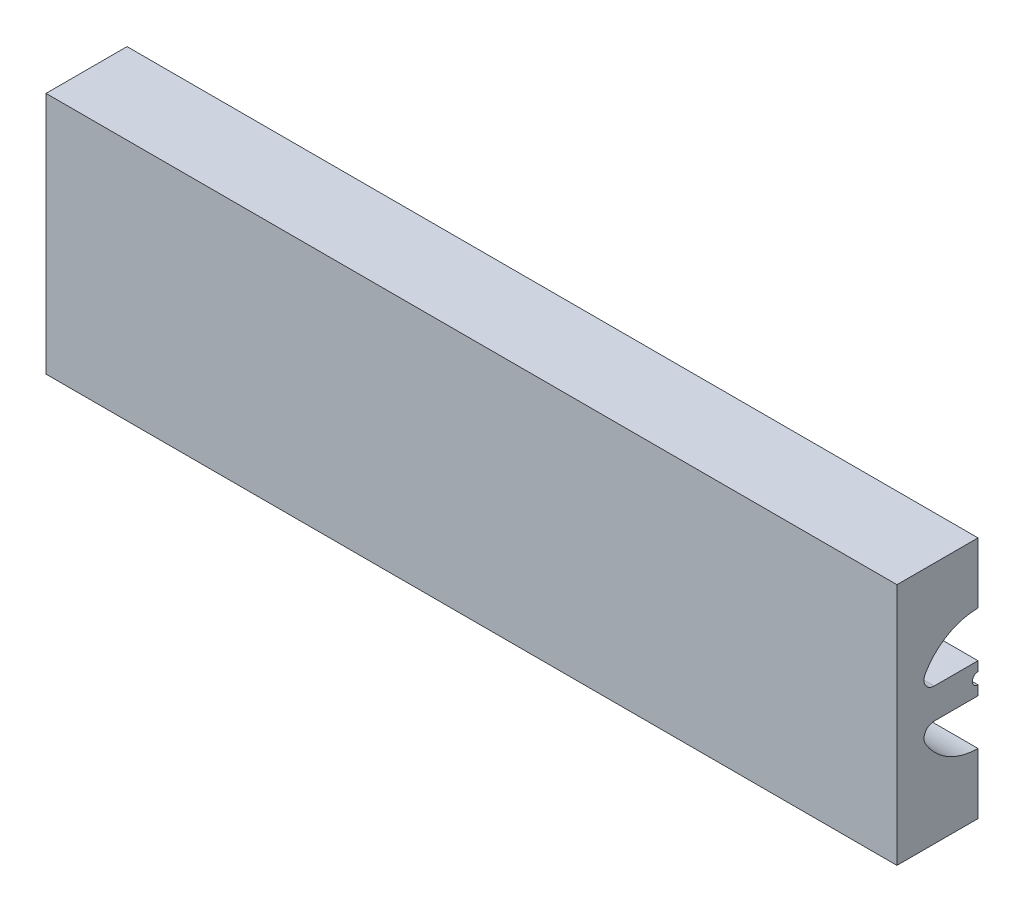
from build123d import *

# Parameters (mm, degrees)
SKETCH2_W                    = 1066.8
SKETCH2_H                    = 304.8
BOSS_EXTRUDE1_DEPTH          = 50.8
CUT_EXTRUDE1_DEPTH           = 1107.294920223
CUT_EXTRUDE1_DEPTH_BACK      = 1107.294920223
SKETCH4_R                    = 7.14375
CUT_EXTRUDE3_DEPTH           = 1037.520325732
FILLET4_R                    = 6.35
REGISTRATION_HOLE_SKETCH_R   = 12.7
BASE_REGISTRATION_HOLE_DEPTH = 50.8
LPATTERN3_COUNT              = 4
LPATTERN3_PITCH              = 304.8
LPATTERN3_COUNT_DIR2         = 2
LPATTERN3_PITCH_DIR2         = 228.6
SKETCH7_R                    = 76.2
CUT_EXTRUDE4_DEPTH           = 12.7
FILLET5_R                    = 12.7


# Read off the part's stored shape, not the designer's step: Indent1
with BuildPart() as part:
    # Sketch2 → Boss-Extrude1 (new, symmetric)
    with BuildSketch(Plane.XY):
        with Locations((1206.465176028, 136.123084384)):
            Rectangle(SKETCH2_W, SKETCH2_H)
    extrude(amount=BOSS_EXTRUDE1_DEPTH, both=True)

    # Indent1 outline → Indent1 (revolve, cut)
    with BuildSketch(Plane(origin=(0, 136.123084384, -50.8), x_dir=(0, 1, 0), z_dir=(0, 0, -1))):
        with BuildLine():
            Line((76.2, 1667.322776028), (0, 1667.322776028))
            Line((0, 1667.322776028), (0, 745.607576028))
            Line((0, 745.607576028), (23.064945381, 745.607576028))
            add(Edge.make_bspline(
                [(23.064945381, 745.607576028), (23.566825523, 748.91437787), (25.363204219, 760.90488429), (28.330664868, 781.598898763), (31.871058885, 807.703400336), (35.241099853, 833.832092117), (38.460845457, 859.980959498), (42.572514827, 894.869141414), (47.400937928, 938.517112788), (52.760650205, 990.942462001), (57.722301111, 1043.408031291), (62.308317352, 1095.908289185), (67.933123727, 1165.949858053), (72.828043506, 1236.047318759), (76.911244662, 1306.192759412), (79.080505646, 1350.052513699), (80.485669281, 1383.896744518), (81.068244998, 1400.195093482), (81.313954963, 1407.717593946)],
                knots=[0.116308657, 0.116308657, 0.116308657, 0.116308657, 0.125901739, 0.151082086, 0.176262434, 0.201442782, 0.22662313, 0.251803477, 0.302164173, 0.352524868, 0.402885564, 0.453246259, 0.503606955, 0.604328346, 0.654689041, 0.705049737, 0.730230084, 0.75181382, 0.75181382, 0.75181382, 0.75181382], degree=3))
            ThreePointArc((81.313954963, 1407.717593946), (80.564993874, 1410.923022844), (78.31179575, 1413.322776028))
            ThreePointArc((78.31179575, 1413.322776028), (76.063072477, 1415.714189378), (75.309046779, 1418.909038266))
            add(Edge.make_bspline(
                [(75.309046779, 1418.909038266), (75.323959024, 1419.411481069), (75.408519742, 1422.276130669), (75.558482998, 1427.503133809), (75.676289458, 1432.228116929), (75.735192688, 1434.590608489), (75.838475179, 1438.733064052), (76.045040161, 1447.017975177), (76.2, 1459.45016933), (76.2, 1467.737655163), (76.2, 1471.88139808), (76.2, 1476.663773407), (76.2, 1486.228524062), (76.2, 1500.575650045), (76.2, 1510.1404007), (76.2, 1514.922776028), (76.2, 1565.722776028), (76.2, 1616.522776028), (76.2, 1667.322776028)],
                knots=[0.761574077, 0.761574077, 0.761574077, 0.761574077, 0.763021384, 0.769825774, 0.776630163, 0.776630163, 0.776630163, 0.788561161, 0.800492159, 0.812423157, 0.812423157, 0.812423157, 0.826192956, 0.839962756, 0.853732555, 0.853732555, 0.853732555, 1, 1, 1, 1], degree=3))
        make_face()
    revolve(axis=Axis((0, 136.123084384, -50.8), (1, 0, 0)), mode=Mode.SUBTRACT)

    # Sketch4 → Cut-Extrude1 (cut, two sides: drawn at the far end of the back side and taken through both)
    with BuildSketch(Plane.ZY.offset(-1739.865176028).offset(-CUT_EXTRUDE1_DEPTH_BACK)):
        with Locations((-50.8, 136.123084384)):
            Circle(SKETCH4_R)
    extrude(amount=CUT_EXTRUDE1_DEPTH + CUT_EXTRUDE1_DEPTH_BACK, mode=Mode.SUBTRACT)

    # Sketch6 → Cut-Extrude3 (cut, through all)
    with BuildSketch(Plane.ZY.offset(-1667.322776028)):
        with BuildLine():
            Line((22.980332745, 117.073084384), (-50.8, 117.073084384))
            Line((-50.8, 117.073084384), (-50.8, 59.923084384))
            ThreePointArc((-50.8, 59.923084384), (-4.1372204, 75.881694958), (22.980332745, 117.073084384))
        make_face()
        with BuildLine():
            Line((-50.8, 155.173084384), (22.980332745, 155.173084384))
            ThreePointArc((22.980332745, 155.173084384), (-4.1372204, 196.364473811), (-50.8, 212.323084384))
            Line((-50.8, 212.323084384), (-50.8, 199.623084384))
            Line((-50.8, 199.623084384), (-50.8, 155.173084384))
        make_face()
    extrude(amount=-CUT_EXTRUDE3_DEPTH, mode=Mode.SUBTRACT)

    # Fillet4
    fillet4_edges = [part.edges().sort_by_distance(p)[0] for p in [
        (745.607576028, 136.123084384, -27.735054619),
    ]]
    fillet(fillet4_edges, radius=FILLET4_R)

    # Registration Hole Sketch → Base-Registration-Hole (cut)
    with BuildSketch(Plane(origin=(0, 0, -50.8), x_dir=(-1, 0, 0), z_dir=(0, 0, -1))):
        with Locations((-745.607576028, 21.823084384)):
            Circle(REGISTRATION_HOLE_SKETCH_R)
    base_registration_hole = extrude(amount=-BASE_REGISTRATION_HOLE_DEPTH, mode=Mode.SUBTRACT)

    # LPattern3: Base-Registration-Hole 4 × 2
    with Locations(*[(i * LPATTERN3_PITCH, j * LPATTERN3_PITCH_DIR2, 0) for i in range(LPATTERN3_COUNT) for j in range(LPATTERN3_COUNT_DIR2) if (i, j) != (0, 0)]):
        add(base_registration_hole, mode=Mode.SUBTRACT)

    # Sketch7 → Cut-Extrude4 (cut)
    with BuildSketch(Plane.ZY.offset(-1667.322776028)):
        with Locations((-50.8, 136.123084384)):
            Circle(SKETCH7_R)
    extrude(amount=-CUT_EXTRUDE4_DEPTH, mode=Mode.SUBTRACT)

    # Fillet5
    # the kernel refuses this fillet: 12.7 mm, written as the material it adds along each edge
    with BuildSketch(Plane(origin=(1680.022776028, 136.123084384, -50.8), x_dir=(0, -0.6204773534699832, 0.7842243644716003), z_dir=(0, -0.7842243644716003, -0.6204773534699832))) as fillet5_piece_1_section:
        with BuildLine():
            CenterArc((76.2 - FILLET5_R, FILLET5_R), FILLET5_R, 270, 90)
            Line((76.2 - FILLET5_R, 0), (76.2, 0))
            Line((76.2, 0), (76.2, FILLET5_R))
        make_face()
    fillet5_piece_1 = revolve(axis=Axis((1680.022776028, 136.123084384, -50.8), (-1, 0, 0)), revolution_arc=38.351001738, mode=Mode.PRIVATE)
    fillet5_piece_1 = split(fillet5_piece_1, bisect_by=Plane(origin=(1677.149054572, 117.073084384, 21.679553224), z_dir=(0, 1, 0)), keep=Keep.TOP, mode=Mode.PRIVATE)
    add(fillet5_piece_1)
    with BuildSketch(Plane(origin=(1680.022776028, 117.073084384, 22.980332745), x_dir=(0, -0.9256147934109615, -0.37846697903355186), z_dir=(1, 0, 0))) as fillet5_piece_2:
        with BuildLine():
            CenterArc((18.865839358, 12.583660567), FILLET5_R, 157.761243907, 120)
            Line((7.110531482, 17.390191201), (0, 0))
            ThreePointArc((0, 0), (10.290457832, -0.698036598), (20.580915663, 0))
        make_face()
    extrude(amount=59.8424)
    with BuildSketch(Plane(origin=(1680.022776028, 155.173084384, 22.980332745), x_dir=(0, 0, -1), z_dir=(1, 0, 0))) as fillet5_piece_3:
        with BuildLine():
            CenterArc((18.787719605, 12.7), FILLET5_R, 150, 120)
            ThreePointArc((7.789196977, 19.05), (3.248485487, 9.789183802), (0, 0))
            Line((0, 0), (18.787719605, 0))
        make_face()
    extrude(amount=59.8424)
    with BuildSketch(Plane(origin=(1680.022776028, 136.123084384, -50.8), x_dir=(0, 0, 1), z_dir=(0, -1, 0))) as fillet5_piece_4_section:
        with BuildLine():
            CenterArc((76.2 - FILLET5_R, FILLET5_R), FILLET5_R, 270, 90)
            Line((76.2, FILLET5_R), (76.2, 0))
            Line((76.2, 0), (76.2 - FILLET5_R, 0))
        make_face()
    fillet5_piece_4 = revolve(axis=Axis((1680.022776028, 136.123084384, -50.8), (-1, 0, 0)), revolution_arc=38.351001738, mode=Mode.PRIVATE)
    fillet5_piece_4 = split(fillet5_piece_4, bisect_by=Plane(origin=(1677.14905497, 155.173084384, 21.679553319), z_dir=(0, -1, 0)), keep=Keep.TOP, mode=Mode.PRIVATE)
    add(fillet5_piece_4)
    with BuildSketch(Plane(origin=(1628.570486869, 117.073084384, 22.980332745), x_dir=(0, -0.9256147934109611, -0.378466979033553), z_dir=(1, 0, 0))) as fillet5_piece_5a_section:
        with BuildLine():
            CenterArc((18.865839358, 12.583660567), FILLET5_R, 157.761243907, 120)
            Line((7.110531482, 17.390191201), (0, 0))
            ThreePointArc((0, 0), (10.290457832, -0.698036598), (20.580915663, 0))
        make_face()
    fillet5_piece_5a = extrude(amount=111.294689159, mode=Mode.PRIVATE)
    fillet5_piece_5a = split(fillet5_piece_5a, bisect_by=Plane(origin=(1680.022776028, 112.40455017, 17.056705553), z_dir=(-1, 0, 0)), keep=Keep.TOP, mode=Mode.PRIVATE)
    with BuildSketch(Plane(origin=(1680.022776028, 136.123084384, -50.8), x_dir=(0, -0.6204773534699832, 0.7842243644716003), z_dir=(0, -0.7842243644716003, -0.6204773534699832))) as fillet5_piece_5b_section:
        with BuildLine():
            CenterArc((76.2 - FILLET5_R, FILLET5_R), FILLET5_R, 270, 90)
            Line((76.2 - FILLET5_R, 0), (76.2, 0))
            Line((76.2, 0), (76.2, FILLET5_R))
        make_face()
    fillet5_piece_5b = revolve(axis=Axis((1680.022776028, 136.123084384, -50.8), (-1, 0, 0)), revolution_arc=38.351001738, mode=Mode.PRIVATE)
    fillet5_piece_5b = split(fillet5_piece_5b, bisect_by=Plane(origin=(1677.047146673, 117.073084384, 14.411791174), z_dir=(0, -1, 0)), keep=Keep.TOP, mode=Mode.PRIVATE)
    fillet5_piece_5 = fillet5_piece_5a & fillet5_piece_5b
    add(fillet5_piece_5)
    with BuildSketch(Plane(origin=(1680.022776028, 136.123084384, -50.8), x_dir=(0, 0, 1), z_dir=(0, -1, 0))) as fillet5_piece_6a_section:
        with BuildLine():
            CenterArc((76.2 - FILLET5_R, FILLET5_R), FILLET5_R, 270, 90)
            Line((76.2, FILLET5_R), (76.2, 0))
            Line((76.2, 0), (76.2 - FILLET5_R, 0))
        make_face()
    fillet5_piece_6a = revolve(axis=Axis((1680.022776028, 136.123084384, -50.8), (-1, 0, 0)), revolution_arc=38.351001738, mode=Mode.PRIVATE)
    fillet5_piece_6a = split(fillet5_piece_6a, bisect_by=Plane(origin=(1677.047146631, 155.173084384, 14.41179131), z_dir=(0, 1, 0)), keep=Keep.TOP, mode=Mode.PRIVATE)
    with BuildSketch(Plane(origin=(1628.570486869, 155.173084384, 22.980332745), x_dir=(0, 0, -1), z_dir=(1, 0, 0))) as fillet5_piece_6b_section:
        with BuildLine():
            CenterArc((18.787719605, 12.7), FILLET5_R, 150, 120)
            ThreePointArc((7.789196977, 19.05), (3.248485487, 9.789183802), (0, 0))
            Line((0, 0), (18.787719605, 0))
        make_face()
    fillet5_piece_6b = extrude(amount=111.294689159, mode=Mode.PRIVATE)
    fillet5_piece_6b = split(fillet5_piece_6b, bisect_by=Plane(origin=(1680.022776028, 159.841618598, 17.056705553), z_dir=(-1, 0, 0)), keep=Keep.TOP, mode=Mode.PRIVATE)
    fillet5_piece_6 = fillet5_piece_6a & fillet5_piece_6b
    add(fillet5_piece_6)


solid = part.part
